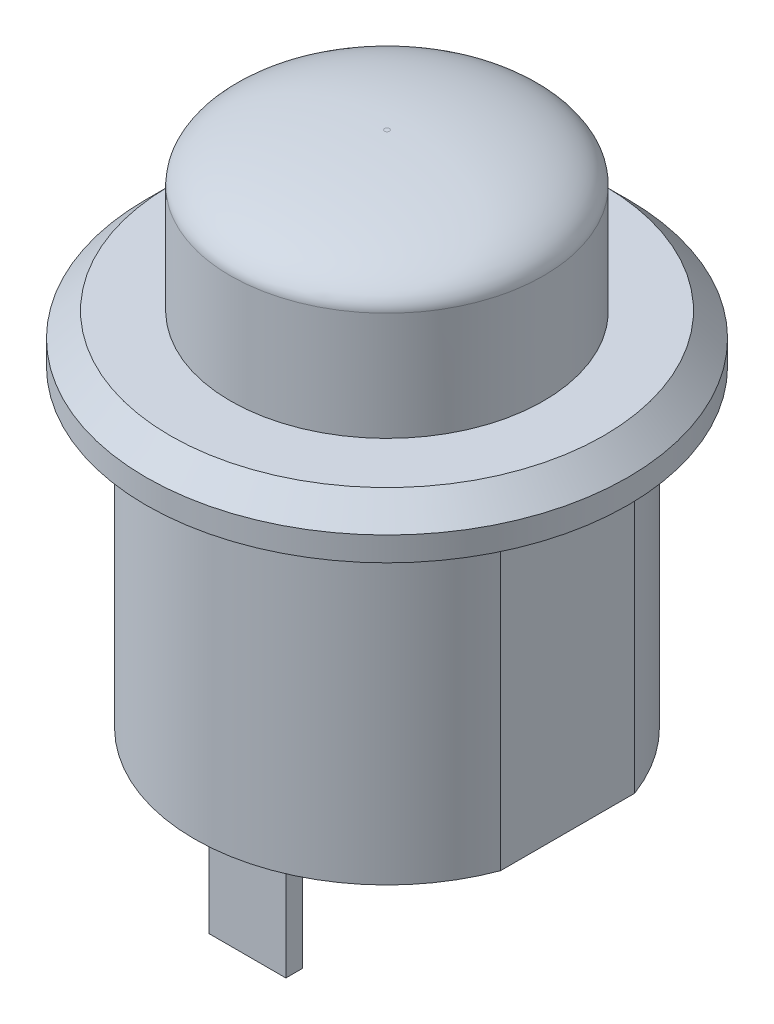
from build123d import *

# Parameters (mm, degrees)
BOSS_EXTRUDE1_DEPTH = 13
SKETCH2_R           = 10
BOSS_EXTRUDE2_DEPTH = 2
CHAMFER1_SIZE       = 1
SKETCH3_R           = 6.5
BOSS_EXTRUDE3_DEPTH = 6.5
FILLET1_SIZE        = 2
FILLET1_SIZE_2      = 6.4
SKETCH4_W           = 3.2
SKETCH4_H           = 0.7
BOSS_EXTRUDE4_DEPTH = 5.3


with BuildPart() as part:
    # Sketch1 → Boss-Extrude1 (new body)
    with BuildSketch(Plane(origin=(0, 0, 0), x_dir=(1, 0, 0), z_dir=(0, 1, 0))):
        with BuildLine():
            Line((-7.5, 2.783882181), (-7.5, -2.783882181))
            ThreePointArc((-7.5, -2.783882181), (0, -8), (7.5, -2.783882181))
            Line((7.5, -2.783882181), (7.5, 2.783882181))
            ThreePointArc((7.5, 2.783882181), (0, 8), (-7.5, 2.783882181))
        make_face()
    extrude(amount=BOSS_EXTRUDE1_DEPTH)

    # Sketch2 → Boss-Extrude2 (add)
    with BuildSketch(Plane(origin=(0, 13, 0), x_dir=(1, 0, 0), z_dir=(0, 1, 0))):
        with Locations(Location((0, 0, 0), (0, 0, 270))):
            Circle(SKETCH2_R)
    extrude(amount=BOSS_EXTRUDE2_DEPTH)

    # Chamfer1
    chamfer1_edges = [part.edges().sort_by_distance(p)[0] for p in [
        (0, 15, -10),
    ]]
    chamfer(chamfer1_edges, length=CHAMFER1_SIZE)

    # Sketch3 → Boss-Extrude3 (add)
    with BuildSketch(Plane(origin=(0, 15, 0), x_dir=(1, 0, 0), z_dir=(0, 1, 0))):
        with Locations(Location((0, 0, 0), (0, 0, 90))):
            Circle(SKETCH3_R)
    extrude(amount=BOSS_EXTRUDE3_DEPTH)

    # Fillet1
    # an asymmetric fillet: 6.4, 2 mm, written as the material it takes off along each edge
    with BuildSketch(Plane(origin=(0, 21.5, 0), x_dir=(0, 0, -1), z_dir=(1, 0, 0))) as fillet1_piece_1:
        with BuildLine():
            Bezier((6.5, -FILLET1_SIZE), (6.5, 0), (6.5 - FILLET1_SIZE_2, 0), weights=[1, 0.707106781, 1])
            Line((6.5 - FILLET1_SIZE_2, 0), (6.5, 0))
            Line((6.5, 0), (6.5, -FILLET1_SIZE))
        make_face()
    revolve(axis=Axis((0, 21.5, 0), (0, 1, 0)), mode=Mode.SUBTRACT)

    # Sketch4 → Boss-Extrude4 (add)
    with BuildSketch(Plane.XZ):
        with Locations((0, 5.45)):
            Rectangle(SKETCH4_W, SKETCH4_H)
        with Locations((0, -5.45)):
            Rectangle(SKETCH4_W, SKETCH4_H)
    extrude(amount=BOSS_EXTRUDE4_DEPTH)


solid = part.part
